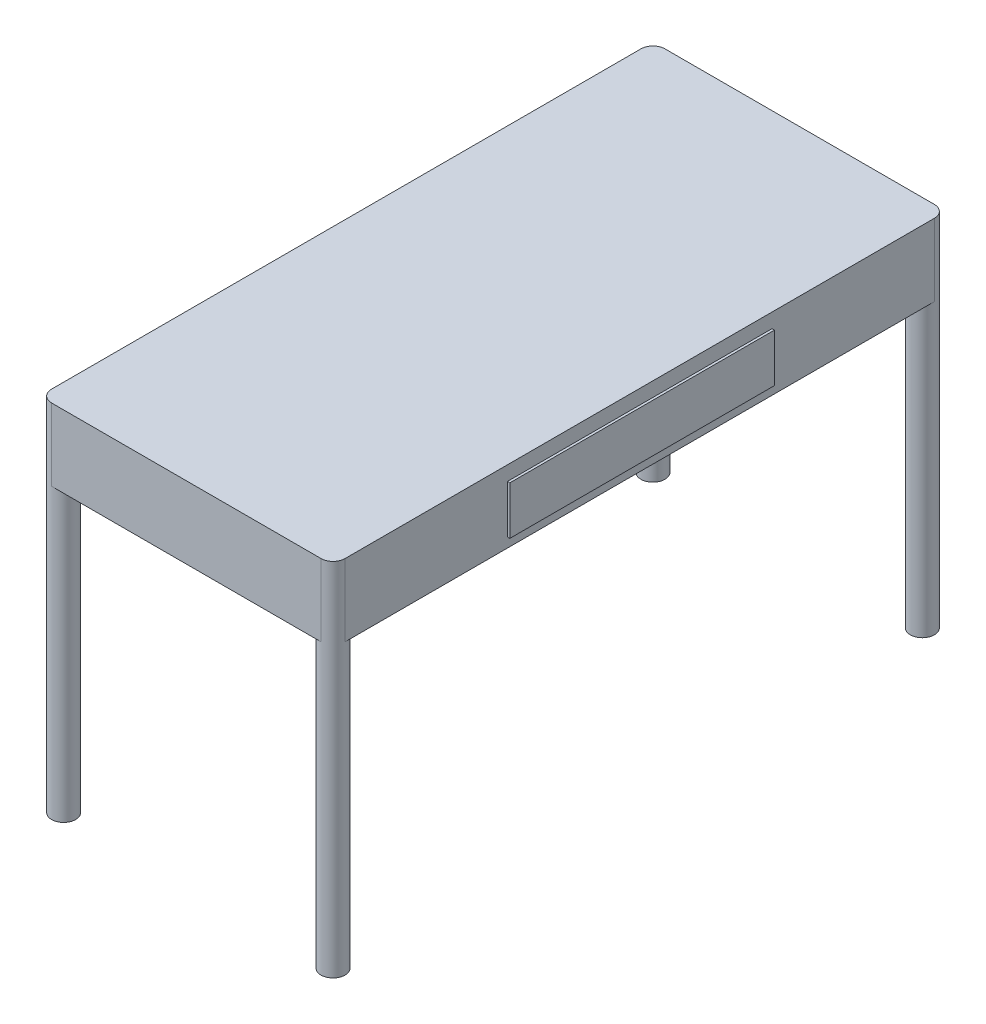
from build123d import *
from build123d.topology import SkipClean

# Parameters (mm, degrees)
SKETCH_2_W               = 610
SKETCH_2_H               = 1275
EXTRUDE_1_DEPTH          = 150
FILLET_1_R               = 25
EXTRUDE_START            = -750
SKETCH_3_R               = 25
EXTRUDE_2_DEPTH          = 750
MIRROR_START             = -750
MIRROR_2_COPY_1_SKETCH_R = 25
MIRROR_2_COPY_1_DEPTH    = 750
SKETCH_4_W               = 550
SKETCH_4_H               = 100
EXTRUDE_3_DEPTH          = 5


with BuildPart() as part:
    # 草图2 → 凸台-拉伸1 (new body)
    with BuildSketch(Plane(origin=(0, 0, 0), x_dir=(1, 0, 0), z_dir=(0, 1, 0))):
        Rectangle(SKETCH_2_W, SKETCH_2_H)
    extrude(amount=-EXTRUDE_1_DEPTH)

    # 圆角1
    fillet_1_edges = [part.edges().sort_by_distance(p)[0] for p in [
        (-305, -75, -637.5),
        (305, -75, -637.5),
        (-305, -75, 637.5),
        (305, -75, 637.5),
    ]]
    fillet(fillet_1_edges, radius=FILLET_1_R)

    # 草图3 → 凸台-拉伸2 (add)
    with SkipClean():  # the faces are left unmerged after this step: merging them gives an invalid solid
        with BuildSketch(Plane(origin=(0, 0, 0), x_dir=(1, 0, 0), z_dir=(0, 1, 0)).offset(EXTRUDE_START)):
            with Locations((280, -612.5)):
                Circle(SKETCH_3_R)
        extrude_2 = extrude(amount=EXTRUDE_2_DEPTH)

    # 镜向1: 凸台-拉伸2 across plane
    with SkipClean():  # the faces are left unmerged after this step: merging them gives an invalid solid
        add(extrude_2.mirror(Plane(origin=(0, 0, 0), x_dir=(0, 0, 1), z_dir=(1, 0, 0))))

    # 镜向2: 凸台-拉伸2 across plane
    with SkipClean():  # the faces are left unmerged after this step: merging them gives an invalid solid
        add(extrude_2.mirror(Plane.XY))

    # 镜向2 copy 1 sketch → 镜向2 copy 1 (add)
    with SkipClean():  # the faces are left unmerged after this step: merging them gives an invalid solid
        with BuildSketch(Plane(origin=(0, 0, 0), x_dir=(-1, 0, 0), z_dir=(0, 1, 0)).offset(MIRROR_START)):
            with Locations((280, -612.5)):
                Circle(MIRROR_2_COPY_1_SKETCH_R)
        extrude(amount=MIRROR_2_COPY_1_DEPTH)

    # 草图4 → 凸台-拉伸3 (add)
    with SkipClean():  # the faces are left unmerged after this step: merging them gives an invalid solid
        with BuildSketch(Plane(origin=(305, 0, 0), x_dir=(0, 0, -1), z_dir=(1, 0, 0))):
            with Locations((0, -80)):
                Rectangle(SKETCH_4_W, SKETCH_4_H)
        extrude(amount=EXTRUDE_3_DEPTH)


solid = part.part
